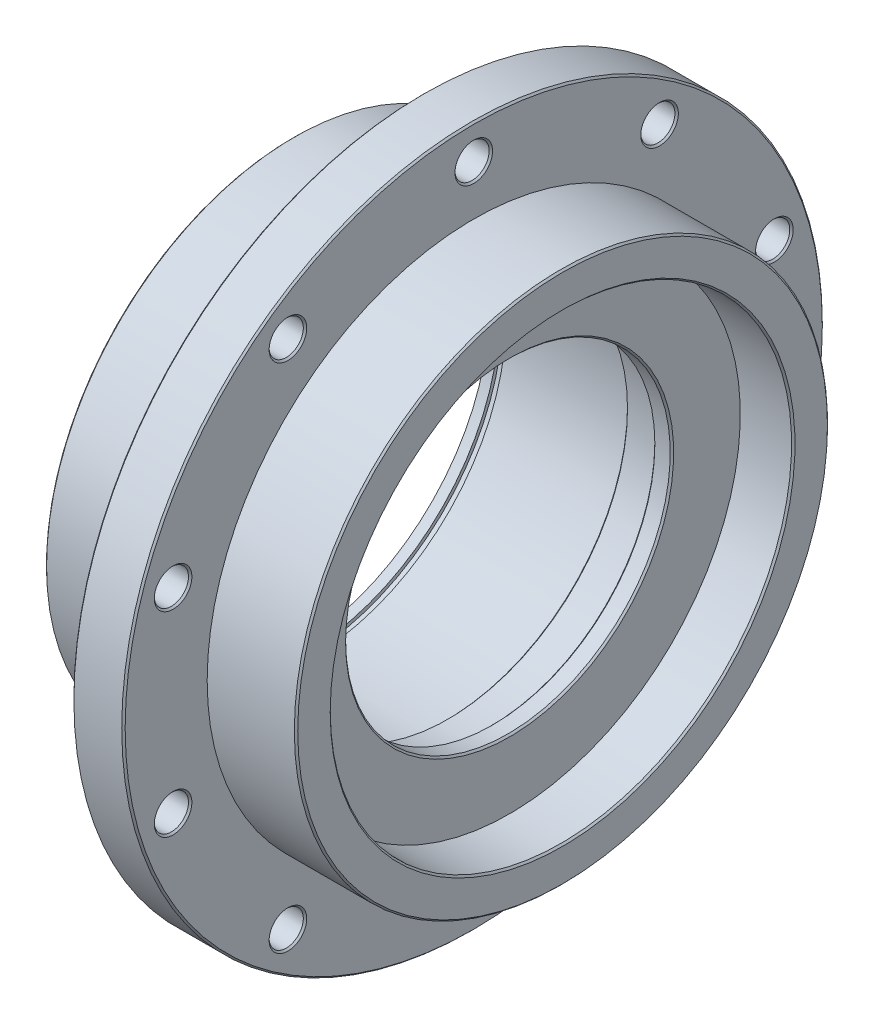
from build123d import *

# Parameters (mm, degrees)
SKETCH_3_R               = 5
CUT_EXTRUDE_2_DEPTH      = 151.643619181
PATTERN_CIRCULAR_1_COUNT = 4
CHAMFER_1_SIZE           = 0.5
CHAMFER_2_SIZE           = 0.5


with BuildPart() as part:
    # 草图1 → 旋转1 (revolve)
    with BuildSketch(Plane.XY):
        Polygon((0, 57.5), (0, 72.5), (38, 72.5), (38, 102.5), (53, 102.5), (53, 78), (79, 78), (79, 67.5), (63.5, 67.5), (63.5, 47.5), (58, 47.5), (58, 52.5), (45, 52.5), (45, 57.5), (5, 57.5), (5, 58.5), (3, 58.5), (3, 57.5), align=None)
    revolve(axis=Axis((0, 0, 0), (1, 0, 0)))

    # 草图3 → 切除-拉伸2 (cut, through all)
    with BuildSketch(Plane.ZY.offset(-38)):
        with Locations((0, 92.5)):
            Circle(SKETCH_3_R)
        with Locations((54.370135837, 74.83407198)):
            Circle(SKETCH_3_R)
        with Locations((87.972727757, 28.58407198)):
            Circle(SKETCH_3_R)
        with Locations((87.972727757, -28.58407198)):
            Circle(SKETCH_3_R)
        with Locations((54.370135837, -74.83407198)):
            Circle(SKETCH_3_R)
        with Locations((0, -92.5)):
            Circle(SKETCH_3_R)
        with Locations((-54.370135837, -74.83407198)):
            Circle(SKETCH_3_R)
        with Locations((-87.972727757, -28.58407198)):
            Circle(SKETCH_3_R)
        with Locations((-87.972727757, 28.58407198)):
            Circle(SKETCH_3_R)
        with Locations((-54.370135837, 74.83407198)):
            Circle(SKETCH_3_R)
    extrude(amount=-CUT_EXTRUDE_2_DEPTH, mode=Mode.SUBTRACT)

    # 草图5 → Ø5.0 (5) 直径孔1 (revolve, cut)
    with BuildSketch(Plane.ZX.offset(65)):
        Polygon((0, 0), (0, 16.502151548), (2.5, 15), (2.5, 0), align=None)
    hole_wizard_5_0_5_1 = revolve(axis=Axis((-6.35, 65, 0), (1, 0, 0)), mode=Mode.SUBTRACT)

    # 阵列(圆周)1: Ø5.0 (5) 直径孔1 ×4 about axis
    pattern_circular_1_axis = Axis((0, 0, 0), (-1, 0, 0))
    for i in range(1, PATTERN_CIRCULAR_1_COUNT):
        add(hole_wizard_5_0_5_1.rotate(pattern_circular_1_axis, i * 360 / PATTERN_CIRCULAR_1_COUNT), mode=Mode.SUBTRACT)

    # 倒角1
    chamfer_1_edges = [part.edges().sort_by_distance(p)[0] for p in [
        (0, -72.5, 0),
        (38, -102.5, 0),
        (53, -102.5, 0),
        (79, -78, 0),
        (45, -52.5, 0),
        (58, -47.5, 0),
        (63.5, -47.5, 0),
        (79, -67.5, 0),
    ]]
    chamfer(chamfer_1_edges, length=CHAMFER_1_SIZE)

    # 倒角2
    chamfer_2_edges = [part.edges().sort_by_distance(p)[0] for p in [
        (0, -65, 2.5),
        (0, 2.5, 65),
        (0, 65, -2.5),
        (0, -2.5, -65),
        (53, 74.83407198, 49.370135837),
        (53, 28.58407198, 82.972727757),
        (53, -28.58407198, 82.972727757),
        (53, -74.83407198, 49.370135837),
        (53, -92.5, -5),
        (53, -74.83407198, -59.370135837),
        (53, -28.58407198, -92.972727757),
        (53, 28.58407198, -92.972727757),
        (53, 74.83407198, -59.370135837),
        (53, 92.5, -5),
        (38, 92.5, -5),
        (38, 74.83407198, 49.370135837),
        (38, 28.58407198, 82.972727757),
        (38, -28.58407198, 82.972727757),
        (38, -74.83407198, 49.370135837),
        (38, -92.5, -5),
        (38, -74.83407198, -59.370135837),
        (38, -28.58407198, -92.972727757),
        (38, 28.58407198, -92.972727757),
        (38, 74.83407198, -59.370135837),
    ]]
    chamfer(chamfer_2_edges, length=CHAMFER_2_SIZE)


solid = part.part
